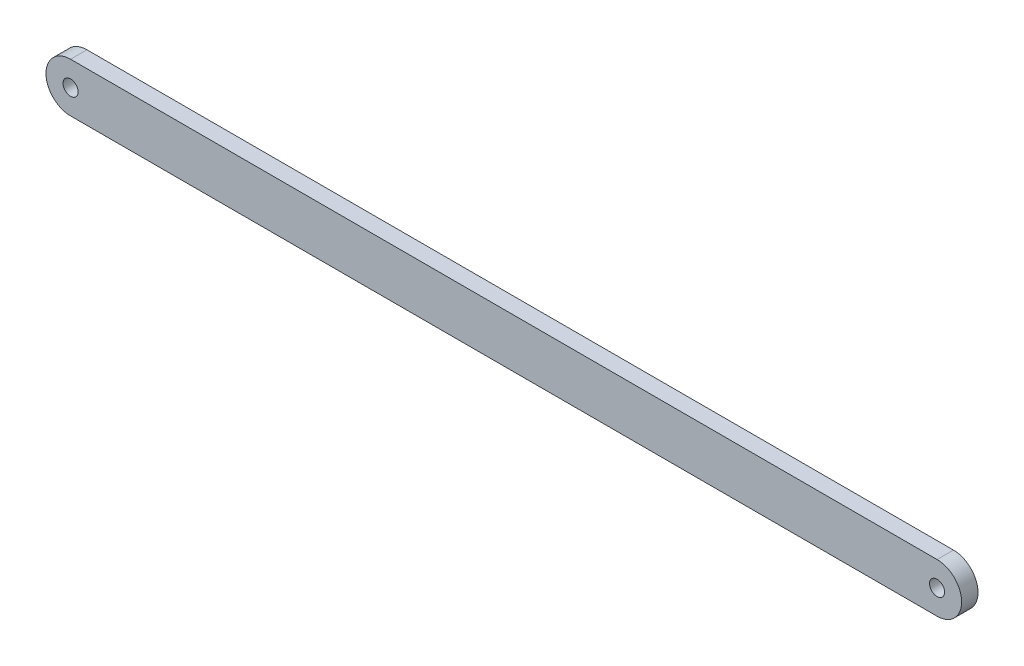
from build123d import *

# Parameters (mm, degrees)
SKETCH_1_R      = 2.3
EXTRUDE_1_DEPTH = 5


with BuildPart() as part:
    # 草图1 → 凸台-拉伸1 (new body)
    with BuildSketch(Plane.XY):
        with BuildLine():
            Line((-132.3, 7.5), (132.3, 7.5))
            ThreePointArc((132.3, 7.5), (139.8, 0), (132.3, -7.5))
            Line((132.3, -7.5), (-132.3, -7.5))
            ThreePointArc((-132.3, -7.5), (-139.8, 0), (-132.3, 7.5))
        make_face()
        with Locations((-132.3, 0)):
            Circle(SKETCH_1_R, mode=Mode.SUBTRACT)
        with Locations((132.3, 0)):
            Circle(SKETCH_1_R, mode=Mode.SUBTRACT)
    extrude(amount=EXTRUDE_1_DEPTH)


solid = part.part
